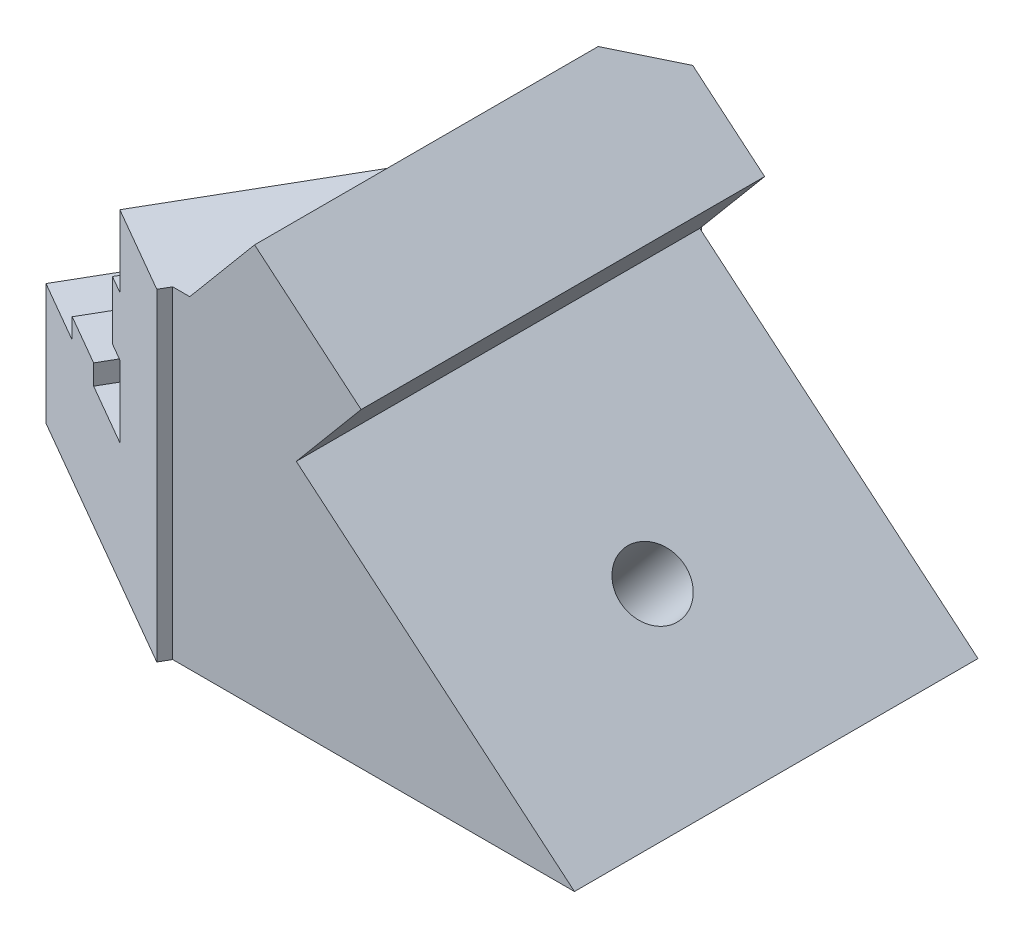
from build123d import *

# Parameters (mm, degrees)
BOSS_EXTRU_1_DEPTH             = 20
ESQUISSE2_R                    = 1.6
HOLEFORLAUNCHERFIXING_DEPTH    = 26.6996017
ESQUISSE3_R                    = 4.25
BIGHOLEFORLAUNCHERFIXING_DEPTH = 28.056770999
ESQUISSE4_W                    = 22.287049145
ESQUISSE4_H                    = 34.815979295
ENL_V_MAT_EXTRU_3_DEPTH        = 6
MAKERBEANFIXING_DEPTH          = 21
ESQUISSE6_W                    = 20
ESQUISSE6_H                    = 6.89158123
BOSS_EXTRU_4_DEPTH             = 5
ESQUISSE7_R                    = 1.6
TOPMAKERBEANFIXINGHOLE_DEPTH   = 33.073784438
ENL_V_MAT_EXTRU_4_DEPTH        = 36.45914211
ESQUISSE9_W                    = 8
ESQUISSE9_H                    = 8
ENL_V_MAT_EXTRU_6_DEPTH        = 40.149455652


with BuildPart() as part:
    # Esquisse1 → Boss.-Extru.1 (new body)
    with BuildSketch(Plane.XY):
        Polygon((2, 16), (21.068057482, 0), (0, 0), (0, 16), align=None)
    extrude(amount=BOSS_EXTRU_1_DEPTH)

    # Esquisse2 → HoleForLauncherFixing (cut, through all)
    with BuildSketch(Plane(origin=(8.704813846, 10.373993174, 0), x_dir=(0, 0, -1), z_dir=(0.6427876096865404, 0.7660444431189772, 0))):
        with Locations((-10, -8.139068361)):
            Circle(ESQUISSE2_R)
    extrude(amount=-HOLEFORLAUNCHERFIXING_DEPTH, mode=Mode.SUBTRACT)

    # Esquisse3 → BigHoleForLauncherFixing (cut, through all)
    with BuildSketch(Plane(origin=(5.490875798, 6.543770959, 0), x_dir=(0, 0, -1), z_dir=(0.6427876096865404, 0.7660444431189772, 0))):
        with Locations((-10, -8.139068361)):
            Circle(ESQUISSE3_R)
    extrude(amount=-BIGHOLEFORLAUNCHERFIXING_DEPTH, mode=Mode.SUBTRACT)

    # Esquisse4 → Enlèv. mat.-Extru.3 (cut)
    with BuildSketch(Plane(origin=(0, 0, 0), x_dir=(0, -1, 0), z_dir=(-0.8660254037844398, 0, -0.499999999999998))):
        with Locations((-6.644134867, 0.407683814)):
            Rectangle(ESQUISSE4_W, ESQUISSE4_H)
    extrude(amount=-ENL_V_MAT_EXTRU_3_DEPTH, mode=Mode.SUBTRACT)

    # Esquisse5 → MakerBeanFixing (add)
    with BuildSketch(Plane(origin=(-3.464101615, 0, 18), x_dir=(-0.8660254037844398, 0, -0.49999999999999806), z_dir=(0.499999999999998, 0, -0.8660254037844397))):
        Polygon((-5, 0), (10, 0), (10, 6), (6.45, 6), (6.45, 7), (3.55, 7), (3.55, 6), (0, 6), (0, 9.55), (1, 9.55), (1, 12.45), (0, 12.45), (0, 16), (-5, 16), align=None)
    extrude(amount=MAKERBEANFIXING_DEPTH)

    # Esquisse6 → Boss.-Extru.4 (add)
    with BuildSketch(Plane(origin=(8.704813846, 10.373993174, 0), x_dir=(0, 0, -1), z_dir=(0.6427876096865404, 0.7660444431189772, 0))):
        with Locations((-10, 5.306722254)):
            Rectangle(ESQUISSE6_W, ESQUISSE6_H)
    extrude(amount=BOSS_EXTRU_4_DEPTH)

    # Esquisse7 → TopMakerBeanFixingHole (cut, through all)
    with BuildSketch(Plane(origin=(0, 7, 0), x_dir=(1, 0, 0), z_dir=(0, 1, 0))):
        with Locations((-2.294228634, -5.973720558)):
            Circle(ESQUISSE7_R)
    extrude(amount=-TOPMAKERBEANFIXINGHOLE_DEPTH, mode=Mode.SUBTRACT)

    # Esquisse8 → Enlèv. mat.-Extru.4 (cut, through all)
    with BuildSketch(Plane(origin=(0, 0, 0), x_dir=(-1, 0, 0), z_dir=(0, 0, -1))):
        Polygon((-7.279257505, 11.570176974), (-21.068057482, 0), (-26.210358359, 6.128355545), (-7.142300877, 22.128355545), (-5.213938048, 19.830222216), (-10.493195554, 15.40039919), align=None)
    extrude(amount=-ENL_V_MAT_EXTRU_4_DEPTH, mode=Mode.SUBTRACT)

    # Esquisse9 → Enlèv. mat.-Extru.6 (cut, through all)
    with BuildSketch(Plane(origin=(-3.464101615, 0, 18), x_dir=(-0.8660254037844397, 0, -0.49999999999999806), z_dir=(0.49999999999999806, 0, -0.8660254037844397))):
        with Locations((4, 16.45)):
            Rectangle(ESQUISSE9_W, ESQUISSE9_H)
    extrude(amount=ENL_V_MAT_EXTRU_6_DEPTH, mode=Mode.SUBTRACT)


solid = part.part
